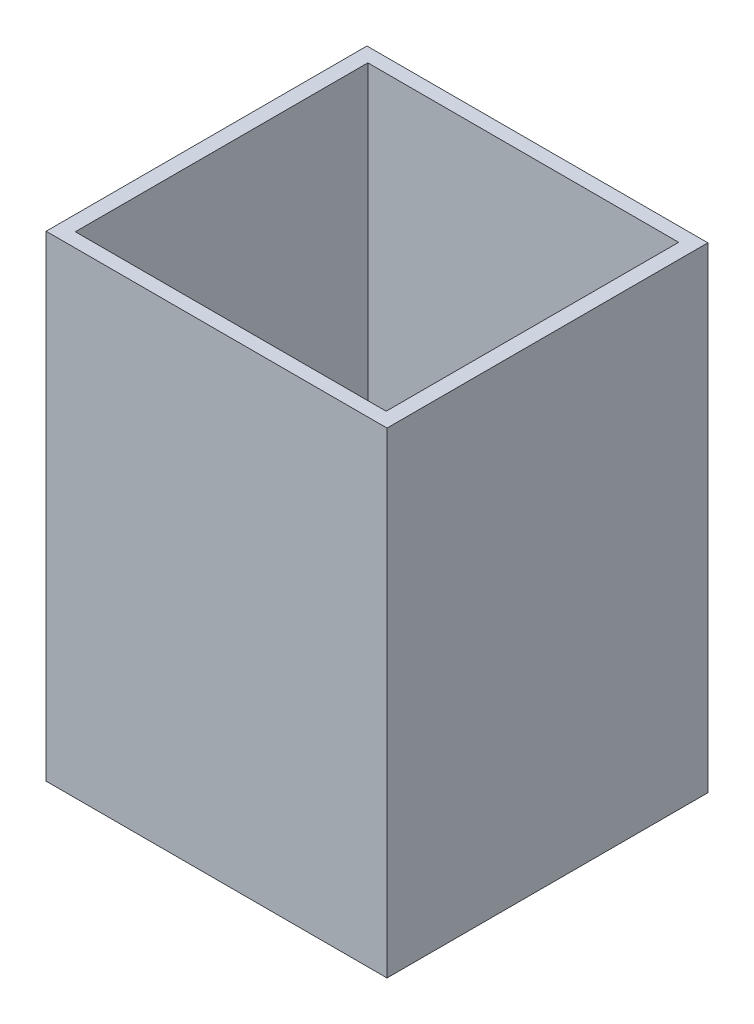
from build123d import *

# Parameters (mm, degrees)
SKETCH1_W           = 68
SKETCH1_H           = 64
BOSS_EXTRUDE1_DEPTH = 80
SKETCH3_W           = 68
SKETCH3_H           = 64
SKETCH3_W_2         = 61.72
SKETCH3_H_2         = 58.089411764
BOSS_EXTRUDE2_DEPTH = 15
SKETCH4_W           = 62
SKETCH4_H           = 58.352941176
CUT_EXTRUDE1_DEPTH  = 75


with BuildPart() as part:
    # Sketch1 → Boss-Extrude1 (new body)
    with BuildSketch(Plane(origin=(0, 0, 0), x_dir=(1, 0, 0), z_dir=(0, 1, 0))):
        Rectangle(SKETCH1_W, SKETCH1_H)
    extrude(amount=BOSS_EXTRUDE1_DEPTH)

    # Sketch3 → Boss-Extrude2 (add)
    with BuildSketch(Plane.XZ):
        Rectangle(SKETCH3_W, SKETCH3_H)
        Rectangle(SKETCH3_W_2, SKETCH3_H_2, mode=Mode.SUBTRACT)
    extrude(amount=BOSS_EXTRUDE2_DEPTH)

    # Sketch4 → Cut-Extrude1 (cut)
    with BuildSketch(Plane(origin=(0, 80, 0), x_dir=(1, 0, 0), z_dir=(0, 1, 0))):
        Rectangle(SKETCH4_W, SKETCH4_H)
    extrude(amount=-CUT_EXTRUDE1_DEPTH, mode=Mode.SUBTRACT)


solid = part.part
